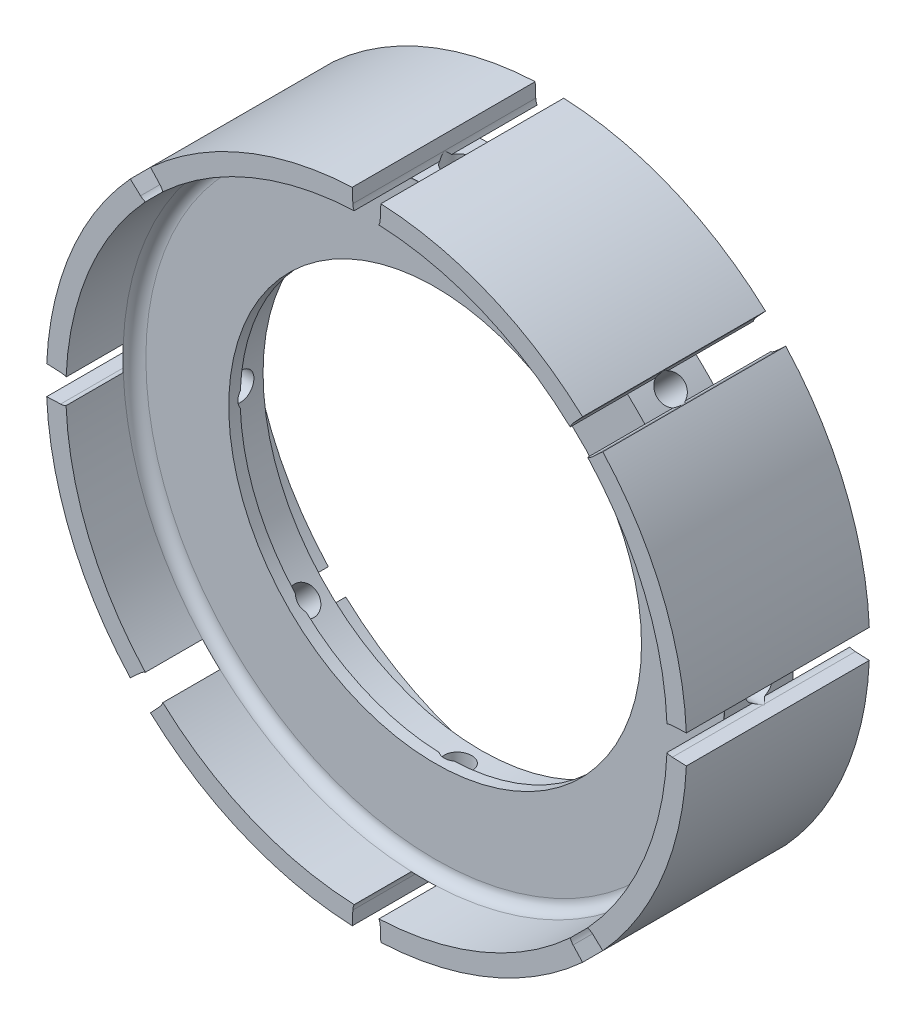
from build123d import *

# Parameters (mm, degrees)
SKETCH1_R           = 14
SKETCH1_R_2         = 13.15
BOSS_EXTRUDE1_DEPTH = 3
BOSS_EXTRUDE2_START = 2
SKETCH2_R           = 14
SKETCH2_R_2         = 9.025
BOSS_EXTRUDE2_DEPTH = 2
BOSS_EXTRUDE3_START = 3
SKETCH3_R           = 14
SKETCH3_R_2         = 13.15
BOSS_EXTRUDE3_DEPTH = 3
FILLET1_R           = 0.5
SKETCH4_R           = 9.525
CUT_EXTRUDE2_DEPTH  = 1.5
CUT_EXTRUDE4_START  = -8
CUT_EXTRUDE4_DEPTH  = 8
SKETCH6_R           = 0.6
CUT_EXTRUDE5_DEPTH  = 10
CIRPATTERN1_COUNT   = 8


# Read off the part's stored shape, not the designer's step: Cut-Extrude4
with BuildPart() as part:
    # Sketch1 → Boss-Extrude1 (new body)
    with BuildSketch(Plane.XY):
        Circle(SKETCH1_R)
        Circle(SKETCH1_R_2, mode=Mode.SUBTRACT)
    extrude(amount=-BOSS_EXTRUDE1_DEPTH)

    # Sketch2 → Boss-Extrude2 (add)
    with BuildSketch(Plane.XY.offset(BOSS_EXTRUDE2_START)):
        Circle(SKETCH2_R)
        Circle(SKETCH2_R_2, mode=Mode.SUBTRACT)
    extrude(amount=-BOSS_EXTRUDE2_DEPTH)

    # Sketch3 → Boss-Extrude3 (add)
    with BuildSketch(Plane.XY.offset(2).offset(BOSS_EXTRUDE3_START)):
        Circle(SKETCH3_R)
        Circle(SKETCH3_R_2, mode=Mode.SUBTRACT)
    extrude(amount=-BOSS_EXTRUDE3_DEPTH)

    # Fillet1
    fillet1_edges = [part.edges().sort_by_distance(p)[0] for p in [
        (-13.15, 0, 0),
        (-13.15, 0, 2),
    ]]
    fillet(fillet1_edges, radius=FILLET1_R)

    # Sketch4 → Cut-Extrude2 (cut)
    with BuildSketch(Plane(origin=(0, 0, 0), x_dir=(-1, 0, 0), z_dir=(0, 0, -1))):
        Circle(SKETCH4_R)
    extrude(amount=-CUT_EXTRUDE2_DEPTH, mode=Mode.SUBTRACT)

    # Cut-Extrude4 outline → Cut-Extrude4 (cut)
    with BuildSketch(Plane(origin=(0, 0, -3), x_dir=(-1, 0, 0), z_dir=(0, 0, -1)).offset(CUT_EXTRUDE4_START)):
        with BuildLine():
            ThreePointArc((-13.138899254, -0.540209589), (-13.15, 0), (-13.138899254, 0.540209589))
            ThreePointArc((-13.138899254, 0.540209589), (-13.254232151, 0.582023826), (-13.375658997, 0.59950606))
            Line((-13.375658997, 0.59950606), (-13.98607386, 0.624289979))
            ThreePointArc((-13.98607386, 0.624289979), (-13.999999989, -0.000544358), (-13.98602527, -0.625377611))
            Line((-13.98602527, -0.625377611), (-13.374591592, -0.599461769))
            ThreePointArc((-13.374591592, -0.599461769), (-13.25371405, -0.581893823), (-13.138899254, -0.540209589))
        make_face()
    cut_extrude4 = extrude(amount=CUT_EXTRUDE4_DEPTH, mode=Mode.SUBTRACT)

    # Sketch6 → Cut-Extrude5 (cut)
    with BuildSketch(Plane(origin=(13.986049565, -0.000543816, 0), x_dir=(0, 0, -1), z_dir=(0.9999999992440667, -3.8882729787074865e-05, 0))):
        with Locations(Location((-1, 0, 0), (0, 0, 64.316355419))):
            Circle(SKETCH6_R)
    cut_extrude5 = extrude(amount=-CUT_EXTRUDE5_DEPTH, mode=Mode.SUBTRACT)

    # CirPattern1: Cut-Extrude4, Cut-Extrude5 ×8 about axis
    cirpattern1_axis = Axis((0, 0, 0), (0, 0, 1))
    add([cut_extrude4.rotate(cirpattern1_axis, i * 360 / CIRPATTERN1_COUNT) for i in range(1, CIRPATTERN1_COUNT)], mode=Mode.SUBTRACT)
    add([cut_extrude5.rotate(cirpattern1_axis, i * 360 / CIRPATTERN1_COUNT) for i in range(1, CIRPATTERN1_COUNT)], mode=Mode.SUBTRACT)


solid = part.part
